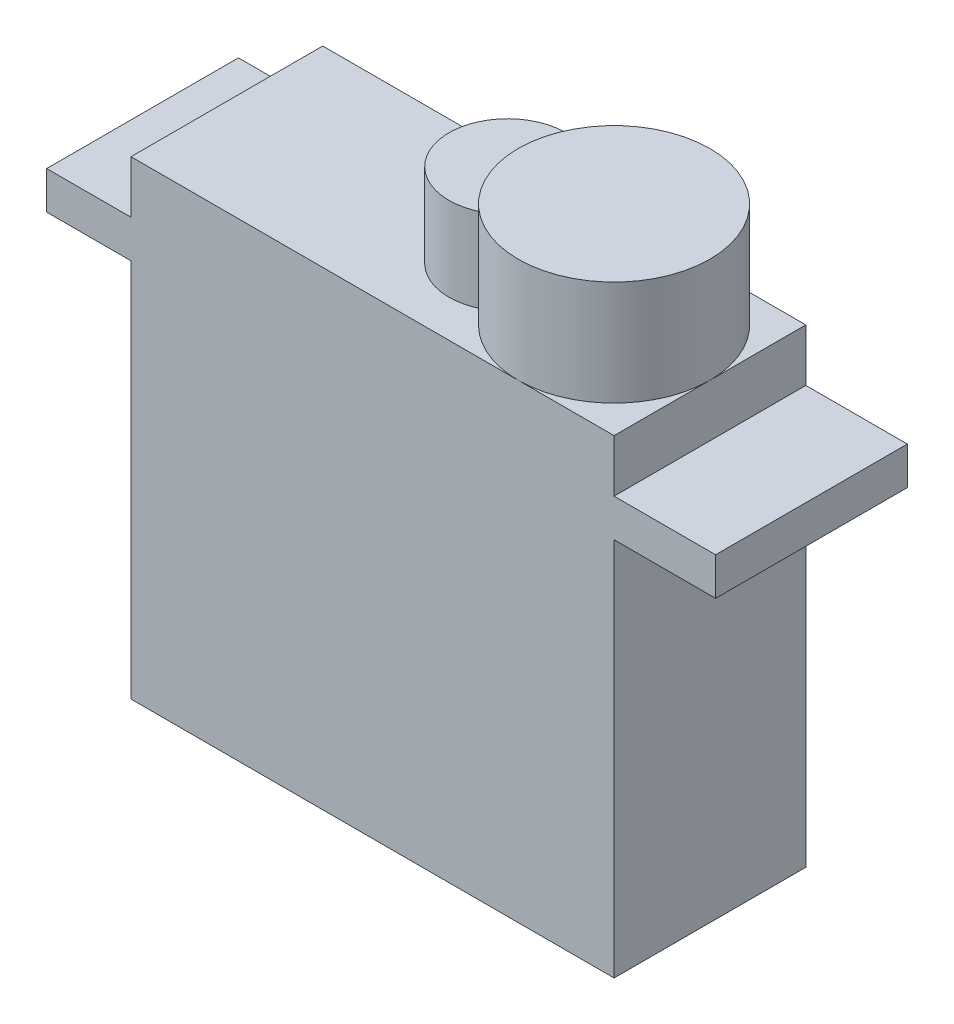
from build123d import *

# Parameters (mm, degrees)
SKETCH1_W           = 23.0378
SKETCH1_H           = 9.144
BOSS_EXTRUDE1_DEPTH = 18.1
SKETCH2_W           = 31.9
SKETCH2_H           = 9.144
BOSS_EXTRUDE2_DEPTH = 1.8
SKETCH3_W           = 23.0378
SKETCH3_H           = 9.144
BOSS_EXTRUDE3_DEPTH = 2.5
SKETCH4_R           = 4.572
BOSS_EXTRUDE4_DEPTH = 5
SKETCH5_R           = 2.794
BOSS_EXTRUDE5_DEPTH = 4


with BuildPart() as part:
    # Sketch1 → Boss-Extrude1 (new body)
    with BuildSketch(Plane(origin=(0, 0, 0), x_dir=(1, 0, 0), z_dir=(0, 1, 0))):
        with Locations((11.5189, 4.572)):
            Rectangle(SKETCH1_W, SKETCH1_H)
    extrude(amount=-BOSS_EXTRUDE1_DEPTH)

    # Sketch2 → Boss-Extrude2 (add)
    with BuildSketch(Plane(origin=(0, 0, 0), x_dir=(1, 0, 0), z_dir=(0, 1, 0))):
        with Locations((11.929019777, 4.572)):
            Rectangle(SKETCH2_W, SKETCH2_H)
    extrude(amount=BOSS_EXTRUDE2_DEPTH)

    # Sketch3 → Boss-Extrude3 (add)
    with BuildSketch(Plane(origin=(0, 1.8, 0), x_dir=(1, 0, 0), z_dir=(0, 1, 0))):
        with Locations((11.5189, 4.572)):
            Rectangle(SKETCH3_W, SKETCH3_H)
    extrude(amount=BOSS_EXTRUDE3_DEPTH)

    # Sketch4 → Boss-Extrude4 (add)
    with BuildSketch(Plane(origin=(0, 4.3, 0), x_dir=(1, 0, 0), z_dir=(0, 1, 0))):
        with Locations((18.4658, 4.572)):
            Circle(SKETCH4_R)
    extrude(amount=BOSS_EXTRUDE4_DEPTH)

    # Sketch5 → Boss-Extrude5 (add)
    with BuildSketch(Plane(origin=(0, 4.3, 0), x_dir=(1, 0, 0), z_dir=(0, 1, 0))):
        with Locations((13.3858, 4.572)):
            Circle(SKETCH5_R)
    extrude(amount=BOSS_EXTRUDE5_DEPTH)


solid = part.part
